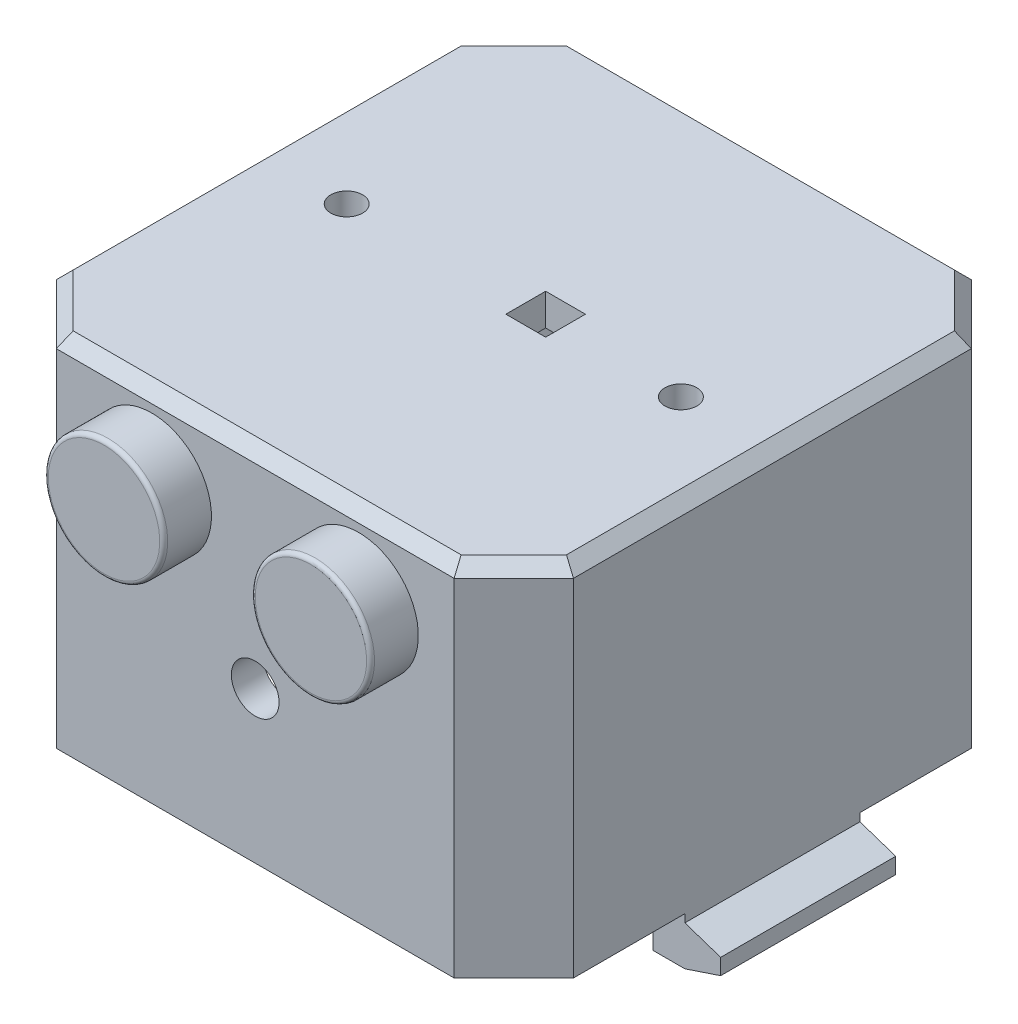
from build123d import *

# Parameters (mm, degrees)
SALIENTE_EXTRUIR1_DEPTH  = 45
VACIADO2_T               = -4
CHAFL_N3_SIZE            = 1.5
CROQUIS2_R               = 7.5
SALIENTE_EXTRUIR2_DEPTH  = 6
CROQUIS4_R               = 5
CORTAR_EXTRUIR2_DEPTH    = 8
REDONDEO1_R              = 0.5
CROQUIS5_R               = 3
CORTAR_EXTRUIR3_DEPTH    = 10
SALIENTE_EXTRUIR8_START  = 8
CROQUIS13_R              = 5
CROQUIS13_R_2            = 2.6
SALIENTE_EXTRUIR8_DEPTH  = 8
CROQUIS7_W               = 4
CROQUIS7_H               = 4
SALIENTE_EXTRUIR3_DEPTH  = 1
CROQUIS8_R               = 2
SALIENTE_EXTRUIR4_DEPTH  = 1
CROQUIS9_R               = 1.6
CORTAR_EXTRUIR5_DEPTH    = 2
CROQUIS12_R              = 1.15
CROQUIS12_R_2            = 0.8
SALIENTE_EXTRUIR7_DEPTH  = 6
CROQUIS14_W              = 3
CROQUIS14_H              = 2.5
SALIENTE_EXTRUIR9_DEPTH  = 5
CROQUIS15_W              = 12
CROQUIS15_H              = 8
CORTAR_EXTRUIR6_DEPTH    = 7
CROQUIS16_W              = 14.5
CROQUIS16_H              = 14.5
CROQUIS16_W_2            = 12.4
CROQUIS16_H_2            = 12.4
SALIENTE_EXTRUIR10_DEPTH = 3
CROQUIS17_R              = 5.5
CORTAR_EXTRUIR7_DEPTH    = 88.007183611
CROQUIS18_W              = 4
CROQUIS18_H              = 22
SALIENTE_EXTRUIR11_DEPTH = 6
SALIENTE_EXTRUIR13_DEPTH = 22
CROQUIS20_W              = 5
CROQUIS20_H              = 5
CORTAR_EXTRUIR8_DEPTH    = 10
CROQUIS10_R              = 2
CORTAR_EXTRUIR10_DEPTH   = 74.839352652


with BuildPart() as part:
    # Croquis1 → Saliente-Extruir1 (new body)
    with BuildSketch(Plane(origin=(0, 0, 0), x_dir=(1, 0, 0), z_dir=(0, 1, 0))):
        Polygon((-25, -32.5), (25, -32.5), (32.5, -25), (32.5, 25), (25, 32.5), (-25, 32.5), (-32.5, 25), (-32.5, -25), align=None)
    extrude(amount=SALIENTE_EXTRUIR1_DEPTH)

    # Vaciado2
    vaciado2_openings = [part.faces().sort_by_distance(p)[0] for p in [
        (0, 0, 0),
    ]]
    offset(amount=VACIADO2_T, openings=vaciado2_openings, kind=Kind.INTERSECTION)

    # Chaflán3
    chafl_n3_edges = [part.edges().sort_by_distance(p)[0] for p in [
        (0, 45, -32.5),
        (32.5, 45, 0),
        (0, 45, 32.5),
        (-32.5, 45, 0),
        (-28.75, 45, 28.75),
        (28.75, 45, 28.75),
        (28.75, 45, -28.75),
        (-28.75, 45, -28.75),
    ]]
    chamfer(chafl_n3_edges, length=CHAFL_N3_SIZE)

    # Croquis2 → Saliente-Extruir2 (add)
    with BuildSketch(Plane.XY.offset(32.5)):
        with Locations((13, 35)):
            Circle(CROQUIS2_R)
        with Locations((-13, 35)):
            Circle(CROQUIS2_R)
    extrude(amount=SALIENTE_EXTRUIR2_DEPTH)

    # Croquis4 → Cortar-Extruir2 (cut)
    with BuildSketch(Plane(origin=(0, 0, 28.5), x_dir=(-1, 0, 0), z_dir=(0, 0, -1))):
        with Locations((-13, 35)):
            Circle(CROQUIS4_R)
        with Locations((13, 35)):
            Circle(CROQUIS4_R)
    extrude(amount=-CORTAR_EXTRUIR2_DEPTH, mode=Mode.SUBTRACT)

    # Redondeo1
    redondeo1_edges = [part.edges().sort_by_distance(p)[0] for p in [
        (-20.5, 35, 38.5),
        (5.5, 35, 38.5),
    ]]
    fillet(redondeo1_edges, radius=REDONDEO1_R)

    # Croquis5 → Cortar-Extruir3 (cut)
    with BuildSketch(Plane.XY.offset(32.5)):
        with Locations((0, 19)):
            Circle(CROQUIS5_R)
    extrude(amount=-CORTAR_EXTRUIR3_DEPTH, mode=Mode.SUBTRACT)

    # Croquis13 → Saliente-Extruir8 (add)
    # profile 1 of 2: a face of its own
    with BuildSketch(Plane(origin=(0, 0, 36.5), x_dir=(-1, 0, 0), z_dir=(0, 0, -1)).offset(SALIENTE_EXTRUIR8_START)):
        with Locations((13, 35)):
            Circle(CROQUIS13_R)
        with Locations((13, 35)):
            Circle(CROQUIS13_R_2, mode=Mode.SUBTRACT)
    # profile 2 of 2: a face of its own
    with BuildSketch(Plane(origin=(0, 0, 36.5), x_dir=(-1, 0, 0), z_dir=(0, 0, -1)).offset(SALIENTE_EXTRUIR8_START)):
        with Locations((-13, 35)):
            Circle(CROQUIS13_R)
        with Locations((-13, 35)):
            Circle(CROQUIS13_R_2, mode=Mode.SUBTRACT)
    extrude(amount=-SALIENTE_EXTRUIR8_DEPTH)

    # Croquis7 → Saliente-Extruir3 (add)
    with BuildSketch(Plane(origin=(0, 0, 28.5), x_dir=(-1, 0, 0), z_dir=(0, 0, -1))):
        with Locations((-11.58, 10.5)):
            Rectangle(CROQUIS7_W, CROQUIS7_H)
        with Locations((-11.58, 28)):
            Rectangle(CROQUIS7_W, CROQUIS7_H)
        with Locations((11.43, 10.5)):
            Rectangle(CROQUIS7_W, CROQUIS7_H)
        with Locations((11.43, 28)):
            Rectangle(CROQUIS7_W, CROQUIS7_H)
    extrude(amount=SALIENTE_EXTRUIR3_DEPTH)

    # Croquis8 → Saliente-Extruir4 (add)
    with BuildSketch(Plane(origin=(0, 0, 27.5), x_dir=(-1, 0, 0), z_dir=(0, 0, -1))):
        with Locations((-11.505, 10.489346828)):
            Circle(CROQUIS8_R)
        with Locations((-11.505, 27.976317365)):
            Circle(CROQUIS8_R)
        with Locations((11.505, 10.489346828)):
            Circle(CROQUIS8_R)
        with Locations((11.505, 27.976317365)):
            Circle(CROQUIS8_R)
    extrude(amount=SALIENTE_EXTRUIR4_DEPTH)

    # Croquis9 → Cortar-Extruir5 (cut)
    with BuildSketch(Plane(origin=(0, 0, 26.5), x_dir=(-1, 0, 0), z_dir=(0, 0, -1))):
        with Locations((-11.505, 27.976317365)):
            Circle(CROQUIS9_R)
        with Locations((-11.505, 10.489346828)):
            Circle(CROQUIS9_R)
        with Locations((11.505, 10.489346828)):
            Circle(CROQUIS9_R)
        with Locations((11.505, 27.976317365)):
            Circle(CROQUIS9_R)
    extrude(amount=-CORTAR_EXTRUIR5_DEPTH, mode=Mode.SUBTRACT)

    # Croquis12 → Saliente-Extruir7 (add)
    # profile 1 of 4: a face of its own
    with BuildSketch(Plane.XZ.offset(-41)):
        with Locations((-20.65, 7.68)):
            Circle(CROQUIS12_R)
        with Locations((-20.65, 7.68)):
            Circle(CROQUIS12_R_2, mode=Mode.SUBTRACT)
    # profile 2 of 4: a face of its own
    with BuildSketch(Plane.XZ.offset(-41)):
        with Locations((-20.65, -7.68)):
            Circle(CROQUIS12_R)
        with Locations((-20.65, -7.68)):
            Circle(CROQUIS12_R_2, mode=Mode.SUBTRACT)
    # profile 3 of 4: a face of its own
    with BuildSketch(Plane.XZ.offset(-41)):
        with Locations((20.65, 7.68)):
            Circle(CROQUIS12_R)
        with Locations((20.65, 7.68)):
            Circle(CROQUIS12_R_2, mode=Mode.SUBTRACT)
    # profile 4 of 4: a face of its own
    with BuildSketch(Plane.XZ.offset(-41)):
        with Locations((20.65, -7.68)):
            Circle(CROQUIS12_R)
        with Locations((20.65, -7.68)):
            Circle(CROQUIS12_R_2, mode=Mode.SUBTRACT)
    extrude(amount=SALIENTE_EXTRUIR7_DEPTH)

    # Croquis14 → Saliente-Extruir9 (add)
    with BuildSketch(Plane.XZ.offset(-41)):
        with Locations((-20.65, 7.68)):
            Rectangle(CROQUIS14_W, CROQUIS14_H)
        with Locations((-20.65, -7.68)):
            Rectangle(CROQUIS14_W, CROQUIS14_H)
        with Locations((20.65, 7.68)):
            Rectangle(CROQUIS14_W, CROQUIS14_H)
        with Locations((20.65, -7.68)):
            Rectangle(CROQUIS14_W, CROQUIS14_H)
    extrude(amount=SALIENTE_EXTRUIR9_DEPTH)

    # Croquis15 → Cortar-Extruir6 (cut)
    with BuildSketch(Plane.ZY.offset(32.5)):
        with Locations((0, 36.5)):
            Rectangle(CROQUIS15_W, CROQUIS15_H)
    extrude(amount=-CORTAR_EXTRUIR6_DEPTH, mode=Mode.SUBTRACT)

    # Croquis16 → Saliente-Extruir10 (add)
    with BuildSketch(Plane.XY.offset(-28.5)):
        with Locations((12.75, 12.25)):
            Rectangle(CROQUIS16_W, CROQUIS16_H)
        with Locations((12.75, 12.25)):
            Rectangle(CROQUIS16_W_2, CROQUIS16_H_2, mode=Mode.SUBTRACT)
    extrude(amount=SALIENTE_EXTRUIR10_DEPTH)

    # Croquis17 → Cortar-Extruir7 (cut, through all)
    with BuildSketch(Plane.XY.offset(-28.5)):
        with Locations((12.75, 12.25)):
            Circle(CROQUIS17_R)
    extrude(amount=-CORTAR_EXTRUIR7_DEPTH, mode=Mode.SUBTRACT)

    # Croquis18 → Saliente-Extruir11 (add)
    with BuildSketch(Plane.XZ):
        with Locations((-30.5, 0)):
            Rectangle(CROQUIS18_W, CROQUIS18_H)
        with Locations((30.5, 0)):
            Rectangle(CROQUIS18_W, CROQUIS18_H)
    extrude(amount=SALIENTE_EXTRUIR11_DEPTH)

    # Croquis19 → Saliente-Extruir13 (add)
    with BuildSketch(Plane.XY.offset(11)):
        Polygon((-32.5, -1), (-37, -2.5), (-37, -4.5), (-32.5, -6), align=None)
        Polygon((32.5, -1), (32.5, -6), (37, -4.5), (37, -2.5), align=None)
    extrude(amount=-SALIENTE_EXTRUIR13_DEPTH)

    # Croquis20 → Cortar-Extruir8 (cut)
    with BuildSketch(Plane(origin=(0, 45, 0), x_dir=(1, 0, 0), z_dir=(0, 1, 0))):
        with Locations((3.50287975, 0.5)):
            Rectangle(CROQUIS20_W, CROQUIS20_H)
    extrude(amount=-CORTAR_EXTRUIR8_DEPTH, mode=Mode.SUBTRACT)

    # Croquis10 → Cortar-Extruir10 (cut, through all)
    with BuildSketch(Plane(origin=(0, 45, 0), x_dir=(1, 0, 0), z_dir=(0, 1, 0))):
        with Locations((-21, 0)):
            Circle(CROQUIS10_R)
        with Locations((21, 0)):
            Circle(CROQUIS10_R)
    extrude(amount=-CORTAR_EXTRUIR10_DEPTH, mode=Mode.SUBTRACT)


solid = part.part
